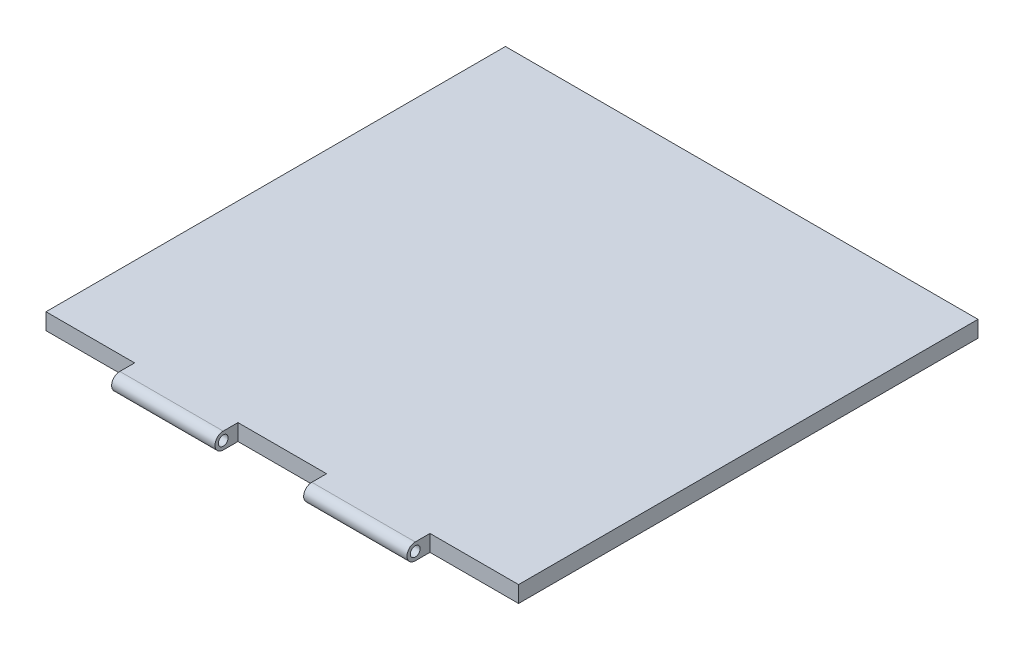
from build123d import *

# Parameters (mm, degrees)
SKETCH3_R               = 0.75
BOSS_EXTRUDE2_DEPTH     = 36
CUT_EXTRUDE1_DEPTH      = 52.910818457
CUT_EXTRUDE1_DEPTH_BACK = 52.910818457
SKETCH4_W               = 13.5
SKETCH4_H               = 3.5
BOSS_EXTRUDE3_DEPTH     = 30


with BuildPart() as part:
    # Sketch3 → Boss-Extrude2 (new, symmetric)
    with BuildSketch(Plane(origin=(0, 0, 0), x_dir=(0, 0, -1), z_dir=(1, 0, 0))):
        with BuildLine():
            Line((-36.125, 1.357368006), (36.125, 1.357368006))
            Line((36.125, 1.357368006), (36.125, -1.142631994))
            Line((36.125, -1.142631994), (-36.125, -1.142631994))
            ThreePointArc((-36.125, -1.142631994), (-37.375, 0.107368006), (-36.125, 1.357368006))
        make_face()
        with Locations((-36.125, 0.107368006)):
            Circle(SKETCH3_R, mode=Mode.SUBTRACT)
    extrude(amount=BOSS_EXTRUDE2_DEPTH, both=True)

    # Sketch4 → Cut-Extrude1 (cut, two sides: drawn at the far end of the back side and taken through both)
    with BuildSketch(Plane(origin=(0, 0, 0), x_dir=(1, 0, 0), z_dir=(0, 1, 0)).offset(-CUT_EXTRUDE1_DEPTH_BACK)):
        with Locations((-29.25, -35.625)):
            Rectangle(SKETCH4_W, SKETCH4_H)
        with Locations((29.25, -35.625)):
            Rectangle(SKETCH4_W, SKETCH4_H)
        with Locations((0, -35.625)):
            Rectangle(SKETCH4_W, SKETCH4_H)
    extrude(amount=CUT_EXTRUDE1_DEPTH + CUT_EXTRUDE1_DEPTH_BACK, mode=Mode.SUBTRACT)

    # Sketch7 → Boss-Extrude3 (add, symmetric)
    with BuildSketch(Plane(origin=(0, 0, 0), x_dir=(0, 0, -1), z_dir=(1, 0, 0))):
        Polygon((30.876330293, -1.142631994), (30.876330293, -3.878672559), (19.808295325, -1.142631994), align=None)
    extrude(amount=BOSS_EXTRUDE3_DEPTH, both=True)


solid = part.part
